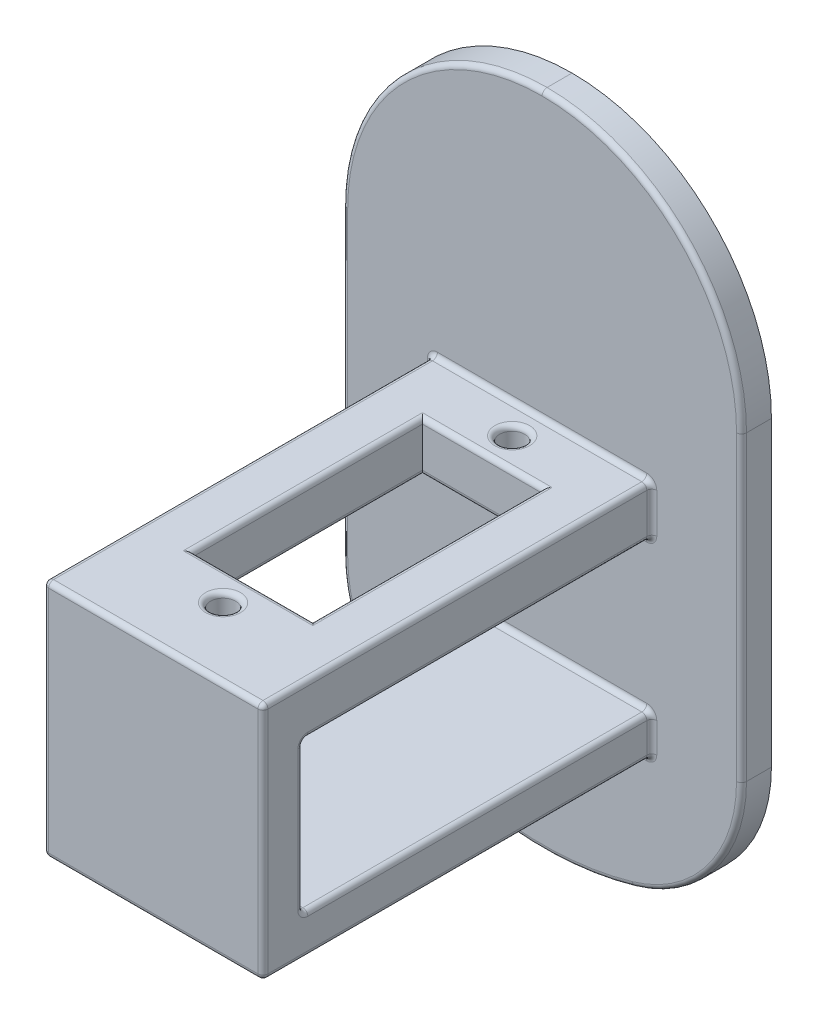
from build123d import *

# Parameters (mm, degrees)
SKETCH1_R           = 33
BOSS_EXTRUDE1_DEPTH = 3
CUT_EXTRUDE3_START  = -10
CUT_EXTRUDE3_DEPTH  = 10
FILLET2_R           = 20
FILLET3_R           = 15
SKETCH4_W           = 22
SKETCH4_H           = 5
BOSS_EXTRUDE2_DEPTH = 35
SKETCH5_W           = 12
SKETCH5_H           = 23
CUT_EXTRUDE1_DEPTH  = 5
SKETCH6_R           = 1.25
CUT_EXTRUDE2_DEPTH  = 5
SKETCH7_W           = 22
SKETCH7_H           = 20
BOSS_EXTRUDE3_DEPTH = 4
SKETCH8_W           = 22
SKETCH8_H           = 39
BOSS_EXTRUDE4_DEPTH = 4
SKETCH9_R           = 3.75
BOSS_EXTRUDE5_DEPTH = 7
FILLET4_R           = 0.5


with BuildPart() as part:
    # Sketch1 → Boss-Extrude1 (new body)
    with BuildSketch(Plane.XY):
        Circle(SKETCH1_R)
    extrude(amount=BOSS_EXTRUDE1_DEPTH)

    # Sketch10 → Cut-Extrude3 (cut)
    with BuildSketch(Plane.XY.offset(3).offset(CUT_EXTRUDE3_START)):
        with BuildLine():
            Line((-20, 26.248809497), (-20, -26.248809497))
            ThreePointArc((-20, -26.248809497), (-33, 0), (-20, 26.248809497))
        make_face()
        with BuildLine():
            Line((20, 26.248809497), (20, -26.248809497))
            ThreePointArc((20, -26.248809497), (33, 0), (20, 26.248809497))
        make_face()
    extrude(amount=CUT_EXTRUDE3_DEPTH, mode=Mode.SUBTRACT)

    # Fillet2
    fillet2_edges = [part.edges().sort_by_distance(p)[0] for p in [
        (-20, 26.248809497, 1.5),
        (20, 26.248809497, 1.5),
    ]]
    fillet(fillet2_edges, radius=FILLET2_R - 0.0001)  # a hair under: the kernel refuses the full size

    # Fillet3
    fillet3_edges = [part.edges().sort_by_distance(p)[0] for p in [
        (-20, -26.248809497, 1.5),
        (20, -26.248809497, 1.5),
    ]]
    fillet(fillet3_edges, radius=FILLET3_R)

    # Sketch4 → Boss-Extrude2 (add)
    with BuildSketch(Plane.XY.offset(3)):
        with Locations((0, 2)):
            Rectangle(SKETCH4_W, SKETCH4_H)
    extrude(amount=BOSS_EXTRUDE2_DEPTH)

    # Sketch5 → Cut-Extrude1 (cut)
    with BuildSketch(Plane(origin=(0, 4.5, 0), x_dir=(1, 0, 0), z_dir=(0, 1, 0))):
        with Locations((0, -20.5)):
            Rectangle(SKETCH5_W, SKETCH5_H)
    extrude(amount=-CUT_EXTRUDE1_DEPTH, mode=Mode.SUBTRACT)

    # Sketch6 → Cut-Extrude2 (cut)
    with BuildSketch(Plane(origin=(0, 4.5, 0), x_dir=(1, 0, 0), z_dir=(0, 1, 0))):
        with Locations(Location((0, -6, 0), (0, 0, 270))):
            Circle(SKETCH6_R)
        with Locations(Location((0, -35, 0), (0, 0, 270))):
            Circle(SKETCH6_R)
    extrude(amount=-CUT_EXTRUDE2_DEPTH, mode=Mode.SUBTRACT)

    # Sketch7 → Boss-Extrude3 (add)
    with BuildSketch(Plane.XY.offset(38)):
        with Locations((0, -5.5)):
            Rectangle(SKETCH7_W, SKETCH7_H)
    extrude(amount=BOSS_EXTRUDE3_DEPTH)

    # Sketch8 → Boss-Extrude4 (add)
    with BuildSketch(Plane.XZ.offset(15.5)):
        with Locations((0, 22.5)):
            Rectangle(SKETCH8_W, SKETCH8_H)
    extrude(amount=BOSS_EXTRUDE4_DEPTH)

    # Sketch9 → Boss-Extrude5 (add)
    with BuildSketch(Plane.XZ.offset(19.5)):
        with Locations(Location((0, 25.5, 0), (0, 0, 270))):
            Circle(SKETCH9_R)
    extrude(amount=BOSS_EXTRUDE5_DEPTH)

    # Fillet4
    fillet4_edges = [part.edges().sort_by_distance(p)[0] for p in [
        (-11, -15.5, 20.5),
        (0, -15.5, 3),
        (-11, -17.5, 3),
        (11, -15.5, 20.5),
        (11, -17.5, 3),
        (-11, -19.5, 22.5),
        (0, -19.5, 3),
        (11, -19.5, 22.5),
        (0, -19.5, 42),
        (0, -19.5, 29.25),
        (0, -26.5, 29.25),
        (20, -2.145758233, 3),
        (14.142219305, 27.14211052, 3),
        (-14.142219305, 27.14211052, 3),
        (0, -33, 3),
        (-20, -2.145758233, 3),
        (-16.989578808, -26.305494654, 3),
        (16.989578808, -26.305494654, 3),
        (11, 2, 3),
        (11, -0.5, 20.5),
        (0, 4.5, 3),
        (11, 4.5, 22.5),
        (-11, 2, 3),
        (-11, 4.5, 22.5),
        (0, -0.5, 3),
        (-11, -0.5, 20.5),
        (0, -0.5, 38),
        (6, -0.5, 20.5),
        (0, -0.5, 32),
        (-6, -0.5, 20.5),
        (0, -0.5, 9),
        (6, 4.5, 20.5),
        (0, 4.5, 9),
        (-6, 4.5, 20.5),
        (0, 4.5, 32),
        (0, -0.5, 4.75),
        (0, 4.5, 4.75),
        (0, -0.5, 33.75),
        (0, 4.5, 33.75),
        (-11, -8, 38),
        (0, -15.5, 38),
        (11, -8, 38),
        (-11, -7.5, 42),
        (11, -7.5, 42),
        (0, 4.5, 42),
    ]]
    fillet(fillet4_edges, radius=FILLET4_R)


solid = part.part
